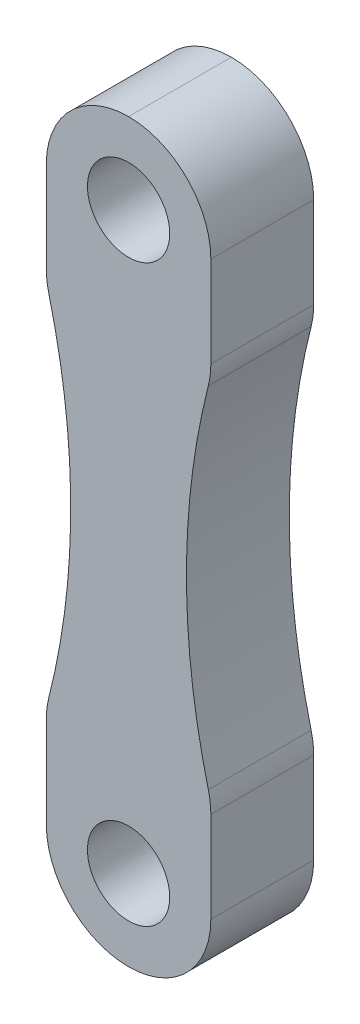
from build123d import *

# Parameters (mm, degrees)
SKETCH1_W          = 16
SKETCH1_H          = 71.6
BODY_DEPTH         = 5
SKETCH2_R          = 4
TOP_HOLE_DEPTH     = 39.021572824
CUT_EXTRUDE1_DEPTH = 39.021572824
FILLET1_R          = 8


with BuildPart() as part:
    # Sketch1 → Body (new, symmetric)
    with BuildSketch(Plane.XY):
        Rectangle(SKETCH1_W, SKETCH1_H)
    extrude(amount=BODY_DEPTH, both=True)

    # Sketch2 → Top Hole (cut, through all)
    with BuildSketch(Plane.XY.offset(5)):
        with Locations((0, 27.94)):
            Circle(SKETCH2_R)
    top_hole = extrude(amount=-TOP_HOLE_DEPTH, mode=Mode.SUBTRACT)

    # Bottom Hole: Top Hole across plane
    add(top_hole.mirror(Plane.ZX), mode=Mode.SUBTRACT)

    # Sketch3 → Cut-Extrude1 (cut, symmetric)
    with BuildSketch(Plane.XY.offset(5)):
        with BuildLine():
            Line((-8, 17.94), (-8, -17.94))
            ThreePointArc((-8, -17.94), (-5.626994529, 0), (-8, 17.94))
        make_face()
    cut_extrude1 = extrude(amount=CUT_EXTRUDE1_DEPTH, both=True, mode=Mode.SUBTRACT)

    # Mirror1: Cut-Extrude1 across plane
    add(cut_extrude1.mirror(Plane(origin=(0, 0, 0), x_dir=(0, 0, 1), z_dir=(1, 0, 0))), mode=Mode.SUBTRACT)

    # Fillet1
    fillet1_edges = [part.edges().sort_by_distance(p)[0] for p in [
        (8, -35.8, 0),
        (-8, -35.8, 0),
        (8, 35.8, 0),
        (-8, 35.8, 0),
        (-8, 17.94, 0),
        (-8, -17.94, 0),
        (8, -17.94, 0),
        (8, 17.94, 0),
    ]]
    fillet(fillet1_edges, radius=FILLET1_R - 0.0001)  # a hair under: the kernel refuses the full size


solid = part.part
